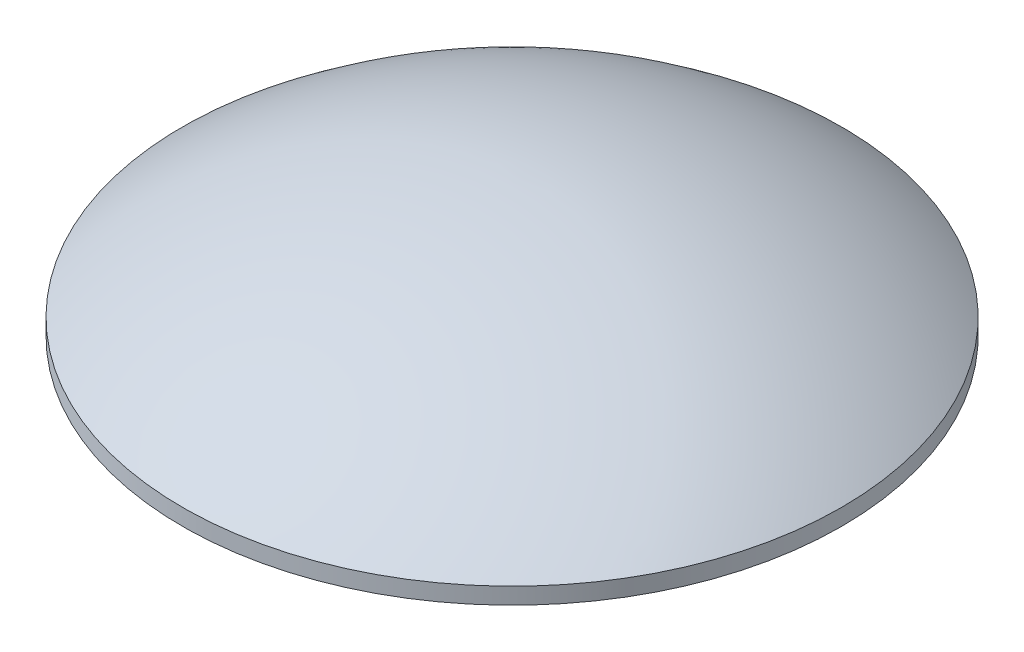
from build123d import *


with BuildPart() as part:
    # Эскиз1 → Повернуть1 (revolve)
    with BuildSketch(Plane.XY):
        with BuildLine():
            Line((0, 12), (0, 0))
            Line((0, 0), (30, 0))
            Line((30, 0), (30, 1.5))
            ThreePointArc((30, 1.5), (15.892215075, 9.299185929), (0, 12))
        make_face()
    revolve(axis=Axis((0, 0, 0), (0, 1, 0)))


solid = part.part
